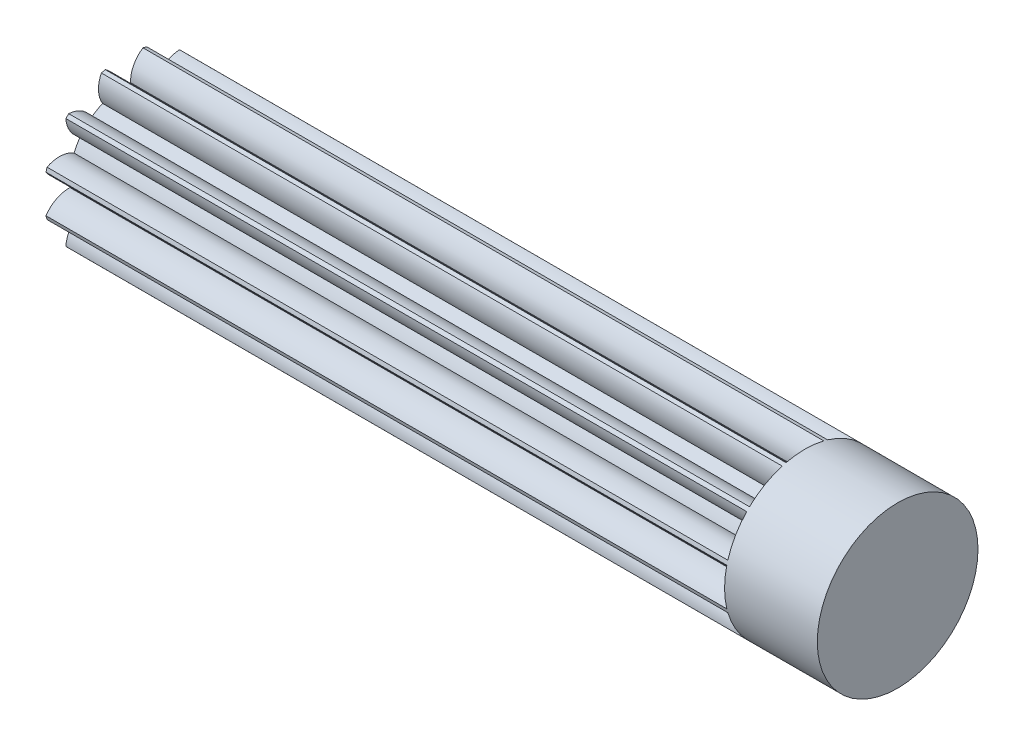
from build123d import *

# Parameters (mm, degrees)
BASPROSKE_W         = 59.315
BASPROSKE_H         = 7
TOOTHCUT_DEPTH      = 61.135424044
TEETHCUTS_COUNT     = 12
TEETHCUTS_ANGLE     = 330
BORSKE_R            = 0.4
BORE_DEPTH          = 50.0000508
SCALE1_SCALE        = 2
SKETCH5_R           = 4
CUT_EXTRUDE2_DEPTH  = 5
CUT_EXTRUDE4_DEPTH  = 15
BOSS_EXTRUDE1_START = 16.163
SKETCH9_R           = 14
BOSS_EXTRUDE1_DEPTH = 16.163


with BuildPart() as part:
    # BasProSke → Base-Revolve (revolve)
    with BuildSketch(Plane(origin=(0, 0, 0), x_dir=(1, 0, 0), z_dir=(0, 1, 0))):
        with Locations((29.6575, 3.5)):
            Rectangle(BASPROSKE_W, BASPROSKE_H)
    revolve(axis=Axis((-10, 0, 0), (1, 0, 0)))

    # TooCutSke → ToothCut (cut, through all)
    with BuildSketch(Plane(origin=(0, 0, 0), x_dir=(0, 0, -1), z_dir=(1, 0, 0))):
        with BuildLine():
            ThreePointArc((0.562207301, 4.715604304), (0, 4.749), (-0.562207301, 4.715604304))
            ThreePointArc((-0.562207301, 4.715604304), (-0.837528627, 5.917009812), (-1.672850686, 6.823328788))
            ThreePointArc((-1.672850686, 6.823328788), (0, 7.0254), (1.672850686, 6.823328788))
            ThreePointArc((1.672850686, 6.823328788), (0.837528627, 5.917009812), (0.562207301, 4.715604304))
        make_face()
    toothcut = extrude(amount=TOOTHCUT_DEPTH, mode=Mode.SUBTRACT)

    # TeethCuts: ToothCut ×12 about axis
    teethcuts_axis = Axis((-10, 0, 0), (1, 0, 0))
    for i in range(1, TEETHCUTS_COUNT):
        add(toothcut.rotate(teethcuts_axis, i * TEETHCUTS_ANGLE / (TEETHCUTS_COUNT - 1)), mode=Mode.SUBTRACT)

    # BorSke → Bore (cut, symmetric)
    with BuildSketch(Plane(origin=(0, 0, 0), x_dir=(0, 0, -1), z_dir=(1, 0, 0))):
        Circle(BORSKE_R)
    extrude(amount=BORE_DEPTH, both=True, mode=Mode.SUBTRACT)


with BuildPart() as part_1:
    # Scale1: scaled about (29.676274456, 0, 0)
    add(part.part.scale(SCALE1_SCALE).moved(Location((-29.676274456, 0, 0))))

    # Sketch5 → Cut-Extrude2 (cut)
    with BuildSketch(Plane.ZY.offset(29.676274456)):
        Circle(SKETCH5_R)
    extrude(amount=-CUT_EXTRUDE2_DEPTH, mode=Mode.SUBTRACT)

    # Sketch8 → Cut-Extrude4 (cut)
    with BuildSketch(Plane.ZY.offset(24.676274456)):
        with BuildLine():
            Line((-1.85, 0), (-1.85, 3.546477125))
            ThreePointArc((-1.85, 3.546477125), (4, 0), (-1.85, -3.546477125))
            Line((-1.85, -3.546477125), (-1.85, 0))
        make_face()
    extrude(amount=-CUT_EXTRUDE4_DEPTH, mode=Mode.SUBTRACT)

    # Sketch9 → Boss-Extrude1 (add)
    with BuildSketch(Plane(origin=(88.953725544, 0, 0), x_dir=(0, 0, -1), z_dir=(1, 0, 0)).offset(BOSS_EXTRUDE1_START)):
        Circle(SKETCH9_R)
    extrude(amount=-BOSS_EXTRUDE1_DEPTH)


solid = part_1.part
